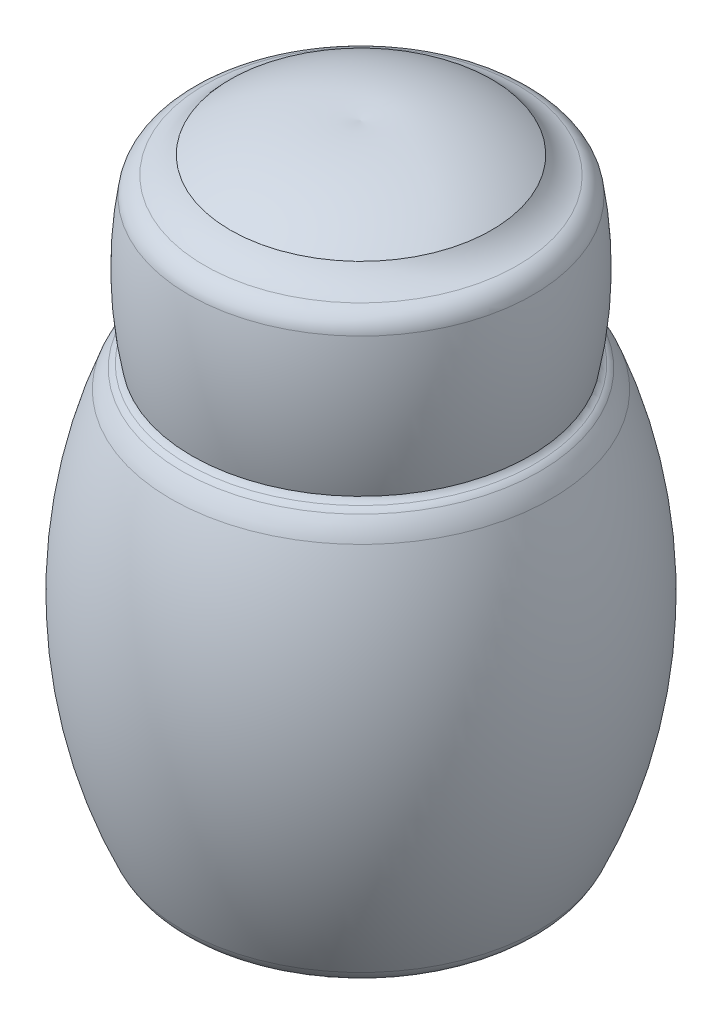
from build123d import *

# Parameters (mm, degrees)
SKETCH3_R          = 81
SKETCH3_R_2        = 77.501248024
CUT_EXTRUDE1_DEPTH = 20


with BuildPart() as part:
    # Sketch2 → Revolve1 (revolve)
    with BuildSketch(Plane.XY):
        with BuildLine():
            ThreePointArc((-12.772354739, 218.935442017), (-16.697181343, 219.73266941), (-20.693225606, 220))
            Line((-20.693225606, 220), (-90, 220))
            Line((-90, 220), (-90, 205))
            Line((-90, 205), (-20.693225606, 205))
            ThreePointArc((-20.693225606, 205), (-12.209917689, 202.370670426), (-6.700664758, 195.404464906))
            ThreePointArc((-6.700664758, 195.404464906), (8.978164508, 103.730969885), (-12.13455183, 13.154435476))
            Line((-12.13455183, 13.154435476), (-19.281789599, 12.479876035))
            Line((-19.281789599, 12.479876035), (-19.281789599, 0))
            Line((-19.281789599, 0), (-4.926165928, 0))
            ThreePointArc((-4.926165928, 0), (-1.147491573, 2.942456876), (1.511165162, 6.92591978))
            ThreePointArc((1.511165162, 6.92591978), (23.971501692, 103.283935109), (7.29189609, 200.808929812))
            ThreePointArc((7.29189609, 200.808929812), (4.841723152, 205.746948655), (1.529394516, 210.153291416))
            ThreePointArc((1.529394516, 210.153291416), (0.336924673, 211.269613546), (-1.021373152, 212.176909774))
            ThreePointArc((-1.021373152, 212.176909774), (-2.392726704, 213.199075341), (-3.446088837, 214.546614293))
            ThreePointArc((-3.446088837, 214.546614293), (-7.919322354, 217.144564755), (-12.772354739, 218.935442017))
        make_face()
    revolve(axis=Axis((-90, -83.445440151, 0), (0, 1, 0)))

    # Sketch3 → Cut-Extrude1 (cut)
    with BuildSketch(Plane.XZ):
        with Locations((-90, 0)):
            Circle(SKETCH3_R)
        with Locations((-90, 0)):
            Circle(SKETCH3_R_2, mode=Mode.SUBTRACT)
    extrude(amount=-CUT_EXTRUDE1_DEPTH, mode=Mode.SUBTRACT)


with BuildPart() as cut_extrude1_piece_1:
    # of the separate pieces the step leaves, piece 1, a body of its own (cut_extrude1_pieces)
    add(part.part.solids().sort_by_distance((1.529394516, 210.153291416, 0))[0])

    # Sketch2<3> → Revolve2 (revolve)
    with BuildSketch(Plane.XY):
        with BuildLine():
            ThreePointArc((-11.862231983, 285.003297377), (-9.42329351, 251.929503182), (-12.772354739, 218.935442017))
            ThreePointArc((-12.772354739, 218.935442017), (-7.919322354, 217.144564755), (-3.446088837, 214.546614293))
            ThreePointArc((-3.446088837, 214.546614293), (0.553999722, 250.510384837), (-1.991545864, 286.606280697))
            ThreePointArc((-1.991545864, 286.606280697), (-4.652261549, 292.294379259), (-9.904304021, 295.73675098))
            ThreePointArc((-9.904304021, 295.73675098), (-17.187539038, 299.287754237), (-23.096112396, 304.832472203))
            ThreePointArc((-23.096112396, 304.832472203), (-55.25085692, 318.13817549), (-90, 320))
            Line((-90, 320), (-90, 310.06706833))
            Line((-90, 310.06706833), (-88.843769727, 310.06706833))
            ThreePointArc((-88.843769727, 310.06706833), (-58.215870113, 308.553321049), (-29.737141439, 297.181352058))
            ThreePointArc((-29.737141439, 297.181352058), (-22.074123671, 290.525213185), (-12.894330874, 286.194228283))
            ThreePointArc((-12.894330874, 286.194228283), (-12.209281855, 285.745223276), (-11.862231983, 285.003297377))
        make_face()
    revolve(axis=Axis((-90, -83.445440151, 0), (0, 1, 0)))


with BuildPart() as cut_extrude1_piece_2:
    # of the separate pieces the step leaves, piece 2, a body of its own (cut_extrude1_pieces)
    add(part.part.solids().sort_by_distance((-12.498751976, 0, 0))[0])


solid = Compound([cut_extrude1_piece_1.part, cut_extrude1_piece_2.part])
